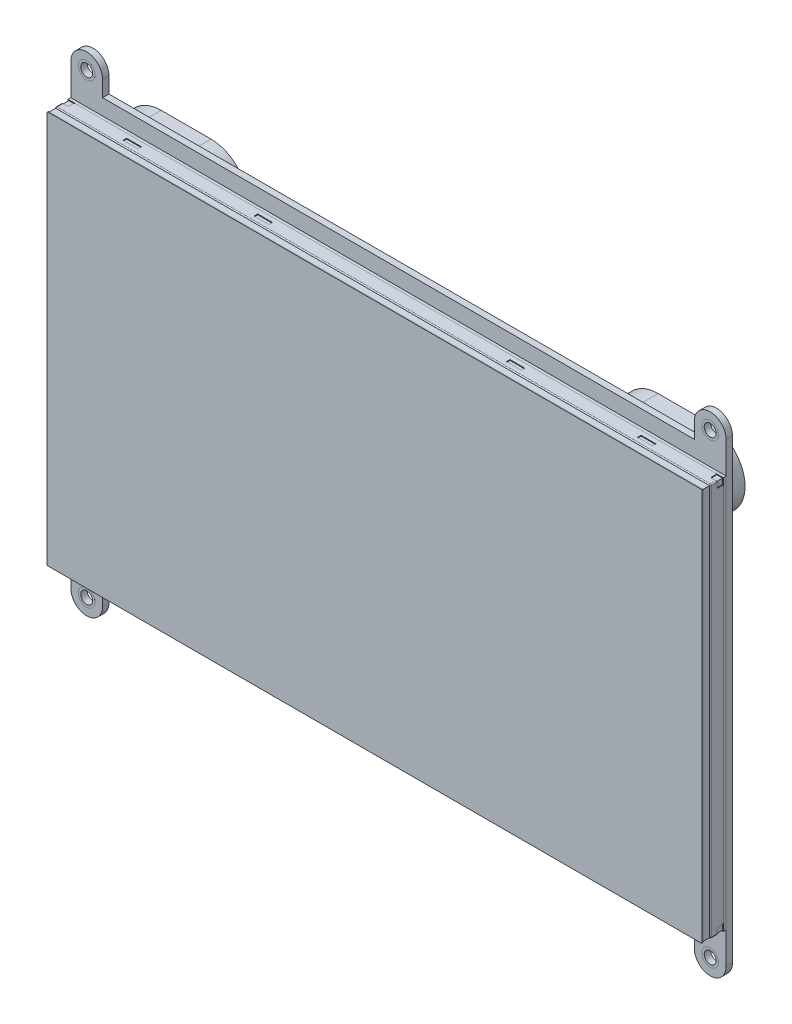
from build123d import *

# Parameters (mm, degrees)
ESBO_O1_W                   = 82.5
ESBO_O1_H                   = 53.5
RESSALTO_EXTRUS_O1_DEPTH    = 1.6
ESBO_O2_R                   = 2.1
RESSALTO_EXTRUS_O2_DEPTH    = 1.6
ESBO_O2_3_R                 = 2.1
ESBO_O2_3_R_2               = 1.5
RESSALTO_EXTRUS_O3_DEPTH    = 1.6
ESBO_O3_W                   = 82.5
ESBO_O3_H                   = 49.5
RESSALTO_EXTRUS_O4_DEPTH    = 0.7
RESSALTO_EXTRUS_O5_START    = 0.7
ESBO_O3_2_W                 = 82.5
ESBO_O3_2_H                 = 49.5
RESSALTO_EXTRUS_O5_DEPTH    = 3.3
RESSALTO_EXTRUS_O6_START    = 4
ESBO_O3_3_W                 = 82.5
ESBO_O3_3_H                 = 49.5
RESSALTO_EXTRUS_O6_DEPTH    = 2
CORTE_EXTRUS_O_FINA1_START  = -0.2
ESBO_O4_W                   = 84.3
ESBO_O4_H                   = 51.3
ESBO_O4_W_2                 = 82.3
ESBO_O4_H_2                 = 49.3
CORTE_EXTRUS_O_FINA1_DEPTH  = 103.980715252
FILETE1_R                   = 0.3
ESBO_O5_W                   = 1.6
ESBO_O5_H                   = 1.6
CORTE_EXTRUS_O1_DEPTH       = 0.2
ESBO_O6_W                   = 1.6
ESBO_O6_H                   = 1.6
CORTE_EXTRUS_O2_DEPTH       = 0.2
FILETE2_R                   = 0.3
FILETE3_R                   = 0.3
CORTE_EXTRUS_O3_START       = 49.3
CORTE_EXTRUS_O3_OUTLINE_W   = 3.725214486
CORTE_EXTRUS_O3_OUTLINE_H   = 0.896810895
CORTE_EXTRUS_O3_DEPTH       = 0.2
PADR_O_LINEAR1_COUNT        = 2
PADR_O_LINEAR1_PITCH        = 33
ESBO_O8_W                   = 7.008875433
ESBO_O8_H                   = 7.634187316
RESSALTO_EXTRUS_O7_DEPTH    = 3.7
ESBO_O8_W_2                 = 6.988801855
ESBO_O8_H_2                 = 7.740262993
RESSALTO_EXTRUS_O7_2_DEPTH  = 3.7
ESBO_O8_W_3                 = 6.093346737
ESBO_O8_H_3                 = 6.180668284
RESSALTO_EXTRUS_O7_3_DEPTH  = 3.7
FILETE4_R                   = 1
PADR_O_LINEAR2_COUNT        = 5
PADR_O_LINEAR2_PITCH        = 11.5
FILETE5_R                   = 2
FILETE6_R                   = 2
CASCA1_T                    = -0.6
CASCA2_T                    = -0.6
ESBO_O8_3_W                 = 13.579499088
ESBO_O8_3_H                 = 13.633579128
RESSALTO_EXTRUS_O8_DEPTH    = 1.7
ESBO_O8_4_W                 = 1.881482806
ESBO_O8_4_H                 = 12.479154109
RESSALTO_EXTRUS_O9_DEPTH    = 0.7
ESBO_O8_4_W_2               = 12.430068315
ESBO_O8_4_H_2               = 1.498503117
RESSALTO_EXTRUS_O9_2_DEPTH  = 0.7
ESBO_O8_4_W_3               = 1.902589059
RESSALTO_EXTRUS_O9_3_DEPTH  = 0.7
ESBO_O8_4_H_3               = 1.971939961
RESSALTO_EXTRUS_O9_4_DEPTH  = 0.7
ESBO_O8_5_W                 = 18.644498438
ESBO_O8_5_H                 = 5.799838425
RESSALTO_EXTRUS_O10_DEPTH   = 1.7
ESBO_O8_5_W_2               = 23.893870835
ESBO_O8_5_H_2               = 5.587913103
RESSALTO_EXTRUS_O10_2_DEPTH = 1.7
ESBO_O8_5_W_3               = 5.675030733
ESBO_O8_5_H_3               = 14.669885557
RESSALTO_EXTRUS_O10_3_DEPTH = 1.7
ESBO_O8_5_W_4               = 6.87322996
ESBO_O8_5_H_4               = 9.843144139
RESSALTO_EXTRUS_O10_4_DEPTH = 1.7
RESSALTO_EXTRUS_O11_DEPTH   = 6.5
RESSALTO_EXTRUS_O11_2_DEPTH = 6.5


# Read off the part's stored shape, not the designer's step: Corte-extrusão3
with BuildPart() as part:
    # Esboço1 → Ressalto-extrusão1 (new body)
    with BuildSketch(Plane.XY):
        with Locations((-41.25, 26.75)):
            Rectangle(ESBO_O1_W, ESBO_O1_H)
    extrude(amount=RESSALTO_EXTRUS_O1_DEPTH)

    # Esboço2 → Ressalto-extrusão2 (add)
    with BuildSketch(Plane.XY):
        with BuildLine():
            Line((-74.5, 57.5), (-74.5, 53.5))
            Line((-74.5, 53.5), (-82.5, 53.5))
            Line((-82.5, 53.5), (-82.5, 57.5))
            ThreePointArc((-82.5, 57.5), (-78.5, 61.5), (-74.5, 57.5))
        make_face()
        with Locations((-78.5, 57.5)):
            Circle(ESBO_O2_R, mode=Mode.SUBTRACT)
    extrude(amount=RESSALTO_EXTRUS_O2_DEPTH)


with BuildPart() as body_2:
    # Esboço2<3> → Ressalto-extrusão3 (new body)
    with BuildSketch(Plane.XY):
        with Locations(Location((-78.5, 57.5, 0), (0, 0, 180))):
            Circle(ESBO_O2_3_R)
        with Locations(Location((-78.5, 57.5, 0), (0, 0, 180))):
            Circle(ESBO_O2_3_R_2, mode=Mode.SUBTRACT)
    extrude(amount=RESSALTO_EXTRUS_O3_DEPTH)


with BuildPart() as body_3:
    # Esboço3 → Ressalto-extrusão4 (new body)
    with BuildSketch(Plane.XY.offset(1.6)):
        with Locations((-41.25, 24.75)):
            Rectangle(ESBO_O3_W, ESBO_O3_H)
    extrude(amount=RESSALTO_EXTRUS_O4_DEPTH)


with BuildPart() as body_4:
    # Esboço3<2> → Ressalto-extrusão5 (new body)
    with BuildSketch(Plane.XY.offset(1.6).offset(RESSALTO_EXTRUS_O5_START)):
        with Locations((-41.25, 24.75)):
            Rectangle(ESBO_O3_2_W, ESBO_O3_2_H)
    extrude(amount=RESSALTO_EXTRUS_O5_DEPTH)

    # Esboço5 → Corte-extrusão1 (cut)
    with BuildSketch(Plane(origin=(0, 49.5, 0), x_dir=(1, 0, 0), z_dir=(0, 1, 0))):
        with Locations((-81.7, -3.1)):
            Rectangle(ESBO_O5_W, ESBO_O5_H)
    extrude(amount=-CORTE_EXTRUS_O1_DEPTH, mode=Mode.SUBTRACT)

    # Esboço6 → Corte-extrusão2 (cut)
    with BuildSketch(Plane.ZY.offset(82.5)):
        with Locations((3.1, 48.7)):
            Rectangle(ESBO_O6_W, ESBO_O6_H)
    extrude(amount=-CORTE_EXTRUS_O2_DEPTH, mode=Mode.SUBTRACT)

    # Filete2
    filete2_edges = [body_4.edges().sort_by_distance(p)[0] for p in [
        (-82.5, 24.75, 5.6),
        (-41.25, 49.5, 5.6),
        (-82.5, 49.5, 4.75),
    ]]
    fillet(filete2_edges, radius=FILETE2_R)

    # Filete3
    filete3_edges = [body_4.edges().sort_by_distance(p)[0] for p in [
        (-80.9, 49.4, 2.3),
        (-80.9, 49.4, 3.9),
        (-82.4, 47.9, 3.9),
        (-82.4, 47.9, 2.3),
    ]]
    fillet(filete3_edges, radius=FILETE3_R)

    # Corte-extrusão3 outline → Corte-extrusão3 (cut)
    with BuildSketch(Plane(origin=(0, 0, 0), x_dir=(1, 0, 0), z_dir=(0, 1, 0)).offset(CORTE_EXTRUS_O3_START)):
        with Locations((-64.774083875, -3.861205878)):
            Rectangle(CORTE_EXTRUS_O3_OUTLINE_W, CORTE_EXTRUS_O3_OUTLINE_H)
    corte_extrus_o3 = extrude(amount=CORTE_EXTRUS_O3_DEPTH, mode=Mode.SUBTRACT)

    # Padrão linear1: Corte-extrusão3 ×2
    with Locations(*[(i * PADR_O_LINEAR1_PITCH, 0, 0) for i in range(1, PADR_O_LINEAR1_COUNT)]):
        add(corte_extrus_o3, mode=Mode.SUBTRACT)


with BuildPart() as body_5:
    # Esboço3<3> → Ressalto-extrusão6 (new body)
    with BuildSketch(Plane.XY.offset(1.6).offset(RESSALTO_EXTRUS_O6_START)):
        with Locations((-41.25, 24.75)):
            Rectangle(ESBO_O3_3_W, ESBO_O3_3_H)
    extrude(amount=RESSALTO_EXTRUS_O6_DEPTH)

    # Esboço4 → Corte-Extrusão-Fina1 (cut, through all)
    with BuildSketch(Plane.XY.offset(7.6).offset(CORTE_EXTRUS_O_FINA1_START)):
        with Locations((-41.15, 24.65)):
            Rectangle(ESBO_O4_W, ESBO_O4_H)
        with Locations((-41.15, 24.65)):
            Rectangle(ESBO_O4_W_2, ESBO_O4_H_2, mode=Mode.SUBTRACT)
    extrude(amount=-CORTE_EXTRUS_O_FINA1_DEPTH, mode=Mode.SUBTRACT)

    # Filete1
    filete1_edges = [body_5.edges().sort_by_distance(p)[0] for p in [
        (-82.5, 49.5, 7.5),
    ]]
    fillet(filete1_edges, radius=FILETE1_R)


with BuildPart() as body_6:
    # Espelhar1: mirrored copy
    add(part.part.mirror(Plane(origin=(0, 0, 5.6), x_dir=(0, 0, 1), z_dir=(1, 0, 0))))


with BuildPart() as body_7:
    # Espelhar1 2: mirrored copy
    add(body_2.part.mirror(Plane(origin=(0, 0, 5.6), x_dir=(0, 0, 1), z_dir=(1, 0, 0))))


with BuildPart() as body_8:
    # Espelhar1 3: mirrored copy
    add(body_3.part.mirror(Plane(origin=(0, 0, 5.6), x_dir=(0, 0, 1), z_dir=(1, 0, 0))))


with BuildPart() as body_9:
    # Espelhar1 4: mirrored copy
    add(body_5.part.mirror(Plane(origin=(0, 0, 5.6), x_dir=(0, 0, 1), z_dir=(1, 0, 0))))


with BuildPart() as body_10:
    # Espelhar1 5: mirrored copy
    add(body_4.part.mirror(Plane(origin=(0, 0, 5.6), x_dir=(0, 0, 1), z_dir=(1, 0, 0))))


with BuildPart() as body_11:
    # Espelhar2: mirrored copy
    add(part.part.mirror(Plane(origin=(0, 0, 5.6), x_dir=(0, 0, 1), z_dir=(0, -1, 0))))


with BuildPart() as body_12:
    # Espelhar2 2: mirrored copy
    add(body_2.part.mirror(Plane(origin=(0, 0, 5.6), x_dir=(0, 0, 1), z_dir=(0, -1, 0))))


with BuildPart() as body_13:
    # Espelhar2 3: mirrored copy
    add(body_3.part.mirror(Plane(origin=(0, 0, 5.6), x_dir=(0, 0, 1), z_dir=(0, -1, 0))))


with BuildPart() as body_14:
    # Espelhar2 4: mirrored copy
    add(body_5.part.mirror(Plane(origin=(0, 0, 5.6), x_dir=(0, 0, 1), z_dir=(0, -1, 0))))


with BuildPart() as body_15:
    # Espelhar2 5: mirrored copy
    add(body_4.part.mirror(Plane(origin=(0, 0, 5.6), x_dir=(0, 0, 1), z_dir=(0, -1, 0))))


with BuildPart() as body_16:
    # Espelhar2 6: mirrored copy
    add(body_6.part.mirror(Plane(origin=(0, 0, 5.6), x_dir=(0, 0, 1), z_dir=(0, -1, 0))))


with BuildPart() as body_17:
    # Espelhar2 7: mirrored copy
    add(body_7.part.mirror(Plane(origin=(0, 0, 5.6), x_dir=(0, 0, 1), z_dir=(0, -1, 0))))


with BuildPart() as body_18:
    # Espelhar2 8: mirrored copy
    add(body_8.part.mirror(Plane(origin=(0, 0, 5.6), x_dir=(0, 0, 1), z_dir=(0, -1, 0))))


with BuildPart() as body_19:
    # Espelhar2 9: mirrored copy
    add(body_9.part.mirror(Plane(origin=(0, 0, 5.6), x_dir=(0, 0, 1), z_dir=(0, -1, 0))))


with BuildPart() as body_20:
    # Espelhar2 10: mirrored copy
    add(body_10.part.mirror(Plane(origin=(0, 0, 5.6), x_dir=(0, 0, 1), z_dir=(0, -1, 0))))


with BuildPart() as body_6_1:
    add(body_6.part)

    # Combinar2: union part, body 11, body 16
    add(part.part)
    add(body_11.part)
    add(body_16.part)


with BuildPart() as body_8_1:
    add(body_8.part)

    # Combinar3: union body 3, body 13, body 18
    add(body_3.part)
    add(body_13.part)
    add(body_18.part)


with BuildPart() as body_10_1:
    add(body_10.part)

    # Combinar4: union body 4, body 15, body 20
    add(body_4.part)
    add(body_15.part)
    add(body_20.part)


with BuildPart() as body_9_1:
    add(body_9.part)

    # Combinar5: union body 5, body 14, body 19
    add(body_5.part)
    add(body_14.part)
    add(body_19.part)


with BuildPart() as body_9_2:
    # Esboço8 → Ressalto-extrusão7 (new body)
    with BuildSketch(Plane(origin=(0, 0, 0), x_dir=(-1, 0, 0), z_dir=(0, 0, -1))):
        with Locations((78.075094535, 0.805069881)):
            Rectangle(ESBO_O8_W, ESBO_O8_H)
    extrude(amount=RESSALTO_EXTRUS_O7_DEPTH)

    # Filete5
    filete5_edges = [body_9_2.edges().sort_by_distance(p)[0] for p in [
        (-78.075094535, -3.012023777, -3.7),
        (-78.075094535, 4.622163539, -3.7),
        (-74.570656818, 0.805069881, -3.7),
    ]]
    fillet(filete5_edges, radius=FILETE5_R)

    # Casca1
    casca1_openings = [body_9_2.faces().sort_by_distance(p)[0] for p in [
        (-81.579532251, 0.805069881, -1.759190589),
    ]]
    offset(amount=CASCA1_T, openings=casca1_openings)


with BuildPart() as body_10_2:
    # Esboço8 → Ressalto-extrus_o7 2 (new body)
    with BuildSketch(Plane(origin=(0, 0, 0), x_dir=(-1, 0, 0), z_dir=(0, 0, -1))):
        with Locations((78.282805829, -14.464015346)):
            Rectangle(ESBO_O8_W_2, ESBO_O8_H_2)
    extrude(amount=RESSALTO_EXTRUS_O7_2_DEPTH)

    # Filete6
    filete6_edges = [body_10_2.edges().sort_by_distance(p)[0] for p in [
        (-78.282805828, -18.334146842, -3.7),
        (-78.282805828, -10.593883849, -3.7),
        (-74.788404901, -14.464015346, -3.7),
    ]]
    fillet(filete6_edges, radius=FILETE6_R)

    # Casca2
    casca2_openings = [body_10_2.faces().sort_by_distance(p)[0] for p in [
        (-81.777206756, -14.464015346, -1.760514438),
    ]]
    offset(amount=CASCA2_T, openings=casca2_openings)


with BuildPart() as body_11_2:
    # Esboço8 → Ressalto-extrus_o7 3 (new body)
    with BuildSketch(Plane(origin=(0, 0, 0), x_dir=(-1, 0, 0), z_dir=(0, 0, -1))):
        with Locations((-75.812578279, 23.558887074)):
            Rectangle(ESBO_O8_W_3, ESBO_O8_H_3)
    extrude(amount=RESSALTO_EXTRUS_O7_3_DEPTH)

    # Filete4
    filete4_edges = [body_11_2.edges().sort_by_distance(p)[0] for p in [
        (72.76590491, 20.468552932, -1.85),
        (78.859251647, 20.468552932, -1.85),
        (78.859251647, 26.649221216, -1.85),
        (72.76590491, 26.649221216, -1.85),
    ]]
    fillet(filete4_edges, radius=FILETE4_R)


with BuildPart() as padr_o_linear2_1:
    # Padrão linear2: pattern copy
    add(body_11_2.part.moved(Location(Vector(0, -1, 0) * (1 * PADR_O_LINEAR2_PITCH))))


with BuildPart() as padr_o_linear2_2:
    # Padrão linear2: pattern copy
    add(body_11_2.part.moved(Location(Vector(0, -1, 0) * (2 * PADR_O_LINEAR2_PITCH))))


with BuildPart() as padr_o_linear2_3:
    # Padrão linear2: pattern copy
    add(body_11_2.part.moved(Location(Vector(0, -1, 0) * (3 * PADR_O_LINEAR2_PITCH))))


with BuildPart() as padr_o_linear2_4:
    # Padrão linear2: pattern copy
    add(body_11_2.part.moved(Location(Vector(0, -1, 0) * (4 * PADR_O_LINEAR2_PITCH))))


with BuildPart() as body_16_2:
    # Esboço8<3> → Ressalto-extrusão8 (new body)
    with BuildSketch(Plane(origin=(0, 0, 0), x_dir=(-1, 0, 0), z_dir=(0, 0, -1))):
        with Locations((40.329745975, 3.08299152)):
            Rectangle(ESBO_O8_3_W, ESBO_O8_3_H)
    extrude(amount=RESSALTO_EXTRUS_O8_DEPTH)


with BuildPart() as body_17_2:
    # Esboço8<4> → Ressalto-extrusão9 (new body)
    with BuildSketch(Plane(origin=(0, 0, 0), x_dir=(-1, 0, 0), z_dir=(0, 0, -1))):
        with Locations((48.060236922, 2.872182175)):
            Rectangle(ESBO_O8_4_W, ESBO_O8_4_H)
    extrude(amount=RESSALTO_EXTRUS_O9_DEPTH)


with BuildPart() as body_18_2:
    # Esboço8<4> → Ressalto-extrus_o9 2 (new body)
    with BuildSketch(Plane(origin=(0, 0, 0), x_dir=(-1, 0, 0), z_dir=(0, 0, -1))):
        with Locations((40.365930867, 10.649032642)):
            Rectangle(ESBO_O8_4_W_2, ESBO_O8_4_H_2)
    extrude(amount=RESSALTO_EXTRUS_O9_2_DEPTH)


with BuildPart() as body_19_2:
    # Esboço8<4> → Ressalto-extrus_o9 3 (new body)
    with BuildSketch(Plane(origin=(0, 0, 0), x_dir=(-1, 0, 0), z_dir=(0, 0, -1))):
        with Locations((32.588701902, 2.872182175)):
            Rectangle(ESBO_O8_4_W_3, ESBO_O8_4_H)
    extrude(amount=RESSALTO_EXTRUS_O9_3_DEPTH)


with BuildPart() as body_20_2:
    # Esboço8<4> → Ressalto-extrus_o9 4 (new body)
    with BuildSketch(Plane(origin=(0, 0, 0), x_dir=(-1, 0, 0), z_dir=(0, 0, -1))):
        with Locations((40.365930867, -4.719768025)):
            Rectangle(ESBO_O8_4_W_2, ESBO_O8_4_H_3)
    extrude(amount=RESSALTO_EXTRUS_O9_4_DEPTH)


with BuildPart() as body_21:
    # Esboço8<5> → Ressalto-extrusão10 (new body)
    with BuildSketch(Plane(origin=(0, 0, 0), x_dir=(-1, 0, 0), z_dir=(0, 0, -1))):
        with Locations((-53.529902778, -4.765649664)):
            Rectangle(ESBO_O8_5_W, ESBO_O8_5_H)
    extrude(amount=RESSALTO_EXTRUS_O10_DEPTH)


with BuildPart() as body_22:
    # Esboço8<5> → Ressalto-extrus_o10 2 (new body)
    with BuildSketch(Plane(origin=(0, 0, 0), x_dir=(-1, 0, 0), z_dir=(0, 0, -1))):
        with Locations((4.887872427, -14.920075283)):
            Rectangle(ESBO_O8_5_W_2, ESBO_O8_5_H_2)
    extrude(amount=RESSALTO_EXTRUS_O10_2_DEPTH)


with BuildPart() as body_23:
    # Esboço8<5> → Ressalto-extrus_o10 3 (new body)
    with BuildSketch(Plane(origin=(0, 0, 0), x_dir=(-1, 0, 0), z_dir=(0, 0, -1))):
        with Locations((63.168701242, -35.7632533)):
            Rectangle(ESBO_O8_5_W_3, ESBO_O8_5_H_3)
    extrude(amount=RESSALTO_EXTRUS_O10_3_DEPTH)


with BuildPart() as body_24:
    # Esboço8<5> → Ressalto-extrus_o10 4 (new body)
    with BuildSketch(Plane(origin=(0, 0, 0), x_dir=(-1, 0, 0), z_dir=(0, 0, -1))):
        with Locations((69.146715837, 21.557928397)):
            Rectangle(ESBO_O8_5_W_4, ESBO_O8_5_H_4)
    extrude(amount=RESSALTO_EXTRUS_O10_4_DEPTH)


with BuildPart() as body_25:
    # Esboço8<6> → Ressalto-extrusão11 (new body)
    with BuildSketch(Plane(origin=(0, 0, 0), x_dir=(-1, 0, 0), z_dir=(0, 0, -1))):
        with BuildLine():
            Line((-69.859147664, 32.201534099), (-57.292035064, 32.201534099))
            ThreePointArc((-57.292035064, 32.201534099), (-47.978644437, 41.514924726), (-57.292035064, 50.828315352))
            Line((-57.292035064, 50.828315352), (-69.859147664, 50.828315352))
            ThreePointArc((-69.859147664, 50.828315352), (-79.17253829, 41.514924726), (-69.859147664, 32.201534099))
        make_face()
    extrude(amount=RESSALTO_EXTRUS_O11_DEPTH)


with BuildPart() as body_26:
    # Esboço8<6> → Ressalto-extrus_o11 2 (new body)
    with BuildSketch(Plane(origin=(0, 0, 0), x_dir=(-1, 0, 0), z_dir=(0, 0, -1))):
        with BuildLine():
            Line((55.284409325, 31.396538196), (67.851521925, 31.396538196))
            ThreePointArc((67.851521925, 31.396538196), (77.164912552, 40.709928823), (67.851521925, 50.023319449))
            Line((67.851521925, 50.023319449), (55.284409325, 50.023319449))
            ThreePointArc((55.284409325, 50.023319449), (45.971018699, 40.709928823), (55.284409325, 31.396538196))
        make_face()
    extrude(amount=RESSALTO_EXTRUS_O11_2_DEPTH)


solid = Compound([body_2.part, body_7.part, body_12.part, body_17.part, body_6_1.part, body_8_1.part, body_10_1.part, body_9_1.part, body_9_2.part, body_10_2.part, body_11_2.part, padr_o_linear2_1.part, padr_o_linear2_2.part, padr_o_linear2_3.part, padr_o_linear2_4.part, body_16_2.part, body_17_2.part, body_18_2.part, body_19_2.part, body_20_2.part, body_21.part, body_22.part, body_23.part, body_24.part, body_25.part, body_26.part])
